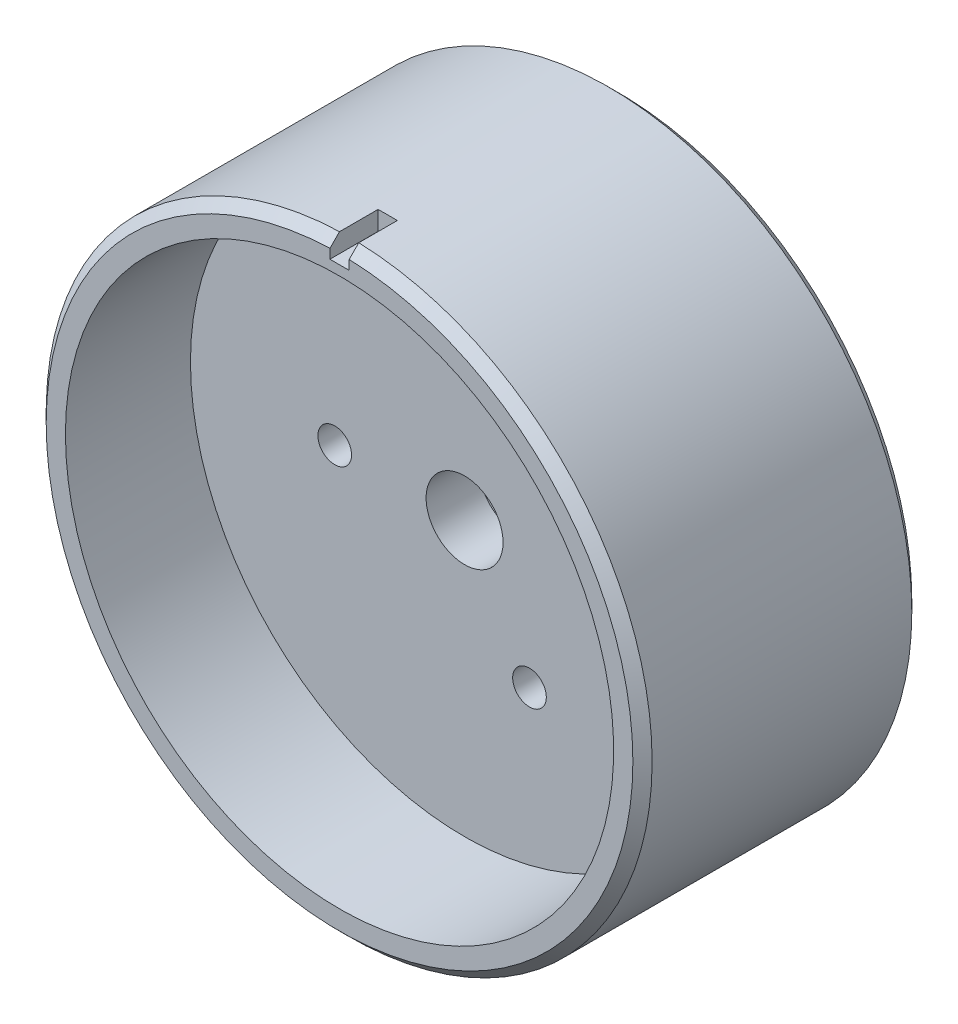
from build123d import *

# Parameters (mm, degrees)
SKETCH_1_R                      = 31.5
SKETCH_1_R_2                    = 1.75
SM_BASE_FLANGE_1_DEPTH          = 16
CHAMFER_1_SIZE                  = 1
SKETCH_12_R                     = 15.75
CUT_EXTRUDE_2_DEPTH             = 6
HOLE_WIZARD_1_D                 = 8
HOLE_WIZARD_1_DEPTH             = 5.5
CHAMFER_2_SIZE                  = 0.5
HOLE_WIZARD_6_0_1_D             = 6
HOLE_WIZARD_6_0_1_DEPTH         = 6
HOLE_WIZARD_6_0_1_TIP           = 1.802581857
SKETCH_11_R                     = 3.25
CUT_EXTRUDE_1_DEPTH             = 4
CUT_EXTRUDE_1_DIRECTION_2_REACH = 47.656
SKETCH_10_R                     = 2.65
CUT_EXTRUDE_41_DEPTH            = 8
SWEEP_3_PITCH                   = 1
PATTERN_CIRCULAR_1_COUNT        = 4
PATTERN_CIRCULAR_2_COUNT        = 2
PATTERN_CIRCULAR_2_ANGLE        = 24
EXTRUDE_START                   = 13
SKETCH_125_R                    = 31.5
SKETCH_125_R_2                  = 28.5
EXTRUDE_1_DEPTH                 = 13
CUT_EXTRUDE_START               = 31.5
SKETCH_124_W                    = 2
SKETCH_124_H                    = 5
CUT_EXTRUDE_42_DEPTH            = 2
CHAMFER_3_SIZE                  = 1


with BuildPart() as part:
    # Базовая кромка1: sheet metal written as solids
    # Sketch 1 → Базовая кромка1 (new body)
    with BuildSketch(Plane.XY):
        Circle(SKETCH_1_R)
        with Locations((-13.5, 0)):
            Circle(SKETCH_1_R_2, mode=Mode.SUBTRACT)
        with Locations((6.75, 11.691342951)):
            Circle(SKETCH_1_R_2, mode=Mode.SUBTRACT)
        with Locations((6.75, -11.691342951)):
            Circle(SKETCH_1_R_2, mode=Mode.SUBTRACT)
    extrude(amount=-SM_BASE_FLANGE_1_DEPTH)

    # Фаска1
    chamfer_1_edges = [part.edges().sort_by_distance(p)[0] for p in [
        (-31.5, 0, -16),
    ]]
    chamfer(chamfer_1_edges, length=CHAMFER_1_SIZE)

    # Эскиз12 → Вырез-Вытянуть2 (cut)
    with BuildSketch(Plane(origin=(0, 0, -16), x_dir=(-1, 0, 0), z_dir=(0, 0, -1))):
        Circle(SKETCH_12_R)
    extrude(amount=-CUT_EXTRUDE_2_DEPTH, mode=Mode.SUBTRACT)

    # Отверстие1
    with Locations(Plane.XY):
        with Locations((0, 0)):
            Hole(HOLE_WIZARD_1_D / 2, depth=HOLE_WIZARD_1_DEPTH)

    # Фаска2
    chamfer_2_edges = [part.edges().sort_by_distance(p)[0] for p in [
        (15.75, 0, -16),
    ]]
    chamfer(chamfer_2_edges, length=CHAMFER_2_SIZE)

    # Отверстия под штифты Ø6.0 мм1
    with Locations(Plane(origin=(0, 25, -16), x_dir=(-1, 0, 0), z_dir=(0, 0, -1))):
        with Locations((0, 0)):
            Hole(HOLE_WIZARD_6_0_1_D / 2, depth=HOLE_WIZARD_6_0_1_DEPTH)
            with Locations((0, 0, -(HOLE_WIZARD_6_0_1_DEPTH + HOLE_WIZARD_6_0_1_TIP / 2))):  # 118° drill point
                Cone(0, HOLE_WIZARD_6_0_1_D / 2, HOLE_WIZARD_6_0_1_TIP, mode=Mode.SUBTRACT)

    # Эскиз11 → Вырез-Вытянуть1 (cut)
    with BuildSketch(Plane(origin=(0, 0, -10), x_dir=(-1, 0, 0), z_dir=(0, 0, -1))):
        with Locations(Location((13.5, 0, 0), (0, 0, 309.022802532))):
            Circle(SKETCH_11_R)
        with Locations(Location((-6.75, -11.691342951, 0), (0, 0, 189.022802465))):
            Circle(SKETCH_11_R)
        with Locations(Location((-6.75, 11.691342951, 0), (0, 0, 170.977197435))):
            Circle(SKETCH_11_R)
    extrude(amount=-CUT_EXTRUDE_1_DEPTH, mode=Mode.SUBTRACT)

    # Эскиз11 → Вырез-Вытянуть1 direction 2 (cut, up to next)
    with BuildSketch(Plane(origin=(0, 0, -10), x_dir=(-1, 0, 0), z_dir=(0, 0, -1)), mode=Mode.PRIVATE) as cut_extrude_1_direction_2_sk1:
        with Locations(Location((13.5, 0, 0), (0, 0, 309.022802532))):
            Circle(SKETCH_11_R)
    cut_extrude_1_direction_2_tool1 = extrude(cut_extrude_1_direction_2_sk1.sketch, amount=CUT_EXTRUDE_1_DIRECTION_2_REACH, mode=Mode.PRIVATE) & part.part
    # Эскиз11 → Вырез-Вытянуть1 direction 2 (cut, up to next)
    with BuildSketch(Plane(origin=(0, 0, -10), x_dir=(-1, 0, 0), z_dir=(0, 0, -1)), mode=Mode.PRIVATE) as cut_extrude_1_direction_2_sk2:
        with Locations(Location((-6.75, -11.691342951, 0), (0, 0, 189.022802465))):
            Circle(SKETCH_11_R)
    cut_extrude_1_direction_2_tool2 = extrude(cut_extrude_1_direction_2_sk2.sketch, amount=CUT_EXTRUDE_1_DIRECTION_2_REACH, mode=Mode.PRIVATE) & part.part
    # Эскиз11 → Вырез-Вытянуть1 direction 2 (cut, up to next)
    with BuildSketch(Plane(origin=(0, 0, -10), x_dir=(-1, 0, 0), z_dir=(0, 0, -1)), mode=Mode.PRIVATE) as cut_extrude_1_direction_2_sk3:
        with Locations(Location((-6.75, 11.691342951, 0), (0, 0, 170.977197435))):
            Circle(SKETCH_11_R)
    cut_extrude_1_direction_2_tool3 = extrude(cut_extrude_1_direction_2_sk3.sketch, amount=CUT_EXTRUDE_1_DIRECTION_2_REACH, mode=Mode.PRIVATE) & part.part
    add(cut_extrude_1_direction_2_tool1.solids().sort_by_distance((-13.5, 0, -10))[0], mode=Mode.SUBTRACT)
    add(cut_extrude_1_direction_2_tool2.solids().sort_by_distance((6.75, -11.691343, -10))[0], mode=Mode.SUBTRACT)
    add(cut_extrude_1_direction_2_tool3.solids().sort_by_distance((6.75, 11.691343, -10))[0], mode=Mode.SUBTRACT)

    # Эскиз10 → Вырез-Вытянуть41 (cut)
    with BuildSketch(Plane(origin=(-35.533284196, 12.717410454, -16), x_dir=(-1, 0, 0), z_dir=(0, 0, -1))):
        with Locations((-53.210953725, 4.960259076)):
            Circle(SKETCH_10_R)
    cut_extrude_41 = extrude(amount=-CUT_EXTRUDE_41_DEPTH, mode=Mode.SUBTRACT)

    # Вырез-По траектории3: arcs per turn and ends read off the stored shape
    # Вырез-По траектории3: the profile of Эскиз121 profile screwed along a right-hand helix through 11 turns, 8 arcs to a turn; built about Z, then put on its axis
    sweep_3_z = Axis((0, 0, 0), (0, 0, 1))
    sweep_3_corners = [(2.6497, 0, -0.549826795), (2.6497, 0, -1.450173205), (3.35, 0, -1.045854812), (3.35, 0, -0.954145188)]
    with BuildLine(mode=Mode.PRIVATE) as sweep_3_profile:
        Line(sweep_3_corners[0], sweep_3_corners[1])
        Line(sweep_3_corners[1], sweep_3_corners[2])
        Line(sweep_3_corners[2], sweep_3_corners[3])
        Line(sweep_3_corners[3], sweep_3_corners[0])
    sweep_3_cap = Face(sweep_3_profile.wire())
    sweep_3_turn_angles = [0, 22.5, 45, 67.5, 90, 112.5, 135, 157.5, 180, 202.5, 225, 247.5, 270, 292.5, 315, 337.5, 360]
    sweep_3_turn_weights = [1, 0.9238795325112867, 1, 0.9238795325112867, 1, 0.9238795325112867, 1, 0.9238795325112867, 1, 0.9238795325112867, 1, 0.9238795325112867, 1, 0.9238795325112867, 1, 0.9238795325112867, 1]
    sweep_3_turn_rails = [Edge.make_bspline([Vector(p[0], p[1], 0).rotate(sweep_3_z, sweep_3_turn_angles[k]) / sweep_3_turn_weights[k] + Vector(0, 0, p[2] + SWEEP_3_PITCH * sweep_3_turn_angles[k] / 360) for k in range(17)], [0, 0, 0, 1, 1, 2, 2, 3, 3, 4, 4, 5, 5, 6, 6, 7, 7, 8, 8, 8], 2, sweep_3_turn_weights) for p in sweep_3_corners]
    sweep_3_turn_sides = [Face.make_surface_from_curves(sweep_3_turn_rails[p[0]], sweep_3_turn_rails[p[1]]) for p in [(0, 1), (1, 2), (2, 3), (3, 0)]]
    sweep_3 = Plane(origin=(17.67766953, 17.67766953, -16), x_dir=(-1, 0, 0), z_dir=(0, 0, 1)) * Solid(Shell([*[p.moved(Location((0, 0, SWEEP_3_PITCH * i))) for i in range(11) for p in sweep_3_turn_sides], sweep_3_cap, sweep_3_cap.rotate(sweep_3_z, 3960).moved(Location((0, 0, SWEEP_3_PITCH * 3960 / 360)))]))
    add(sweep_3, mode=Mode.SUBTRACT)

    # Круговой массив1: Вырез-Вытянуть41, Вырез-По траектории3 ×4 about axis
    pattern_circular_1_axis = Axis((0, 0, -16), (0, 0, 1))
    add([cut_extrude_41.rotate(pattern_circular_1_axis, i * 360 / PATTERN_CIRCULAR_1_COUNT) for i in range(1, PATTERN_CIRCULAR_1_COUNT)], mode=Mode.SUBTRACT)
    add([sweep_3.rotate(pattern_circular_1_axis, i * 360 / PATTERN_CIRCULAR_1_COUNT) for i in range(1, PATTERN_CIRCULAR_1_COUNT)], mode=Mode.SUBTRACT)

    # Эскиз123 → Вырез-Повернуть1 (revolve, cut)
    with BuildSketch(Plane(origin=(0, 0, -8.5), x_dir=(-1, 0, 0), z_dir=(0, 0, -1)), mode=Mode.PRIVATE) as cut_revolve_1_sk:
        Polygon((22.858890762, -2.543838267), (22.632157351, -4.581261139), (31.576940693, -5.576676113), (31.803674104, -3.53925324), align=None)
    cut_revolve_1 = revolve(cut_revolve_1_sk.sketch.rotate(Axis((0, 0, -8.5), (-0.9938648157435338, -0.11060166376267475, 0)), 180), axis=Axis((0, 0, -8.5), (-0.9938648157435338, -0.11060166376267475, 0)), mode=Mode.SUBTRACT)

    # Круговой массив2: Вырез-Повернуть1 ×2 about axis
    pattern_circular_2_axis = Axis((0, 0, -16), (0, 0, -1))
    for i in range(1, PATTERN_CIRCULAR_2_COUNT):
        add(cut_revolve_1.rotate(pattern_circular_2_axis, i * PATTERN_CIRCULAR_2_ANGLE / (PATTERN_CIRCULAR_2_COUNT - 1)), mode=Mode.SUBTRACT)

    # Эскиз125 → Бобышка-Вытянуть1 (add)
    with BuildSketch(Plane.XY.offset(EXTRUDE_START)):
        Circle(SKETCH_125_R)
        with Locations(Location((0, 0, 0), (0, 0, 180))):
            Circle(SKETCH_125_R_2, mode=Mode.SUBTRACT)
    extrude(amount=-EXTRUDE_1_DEPTH)

    # Эскиз124 → Вырез-Вытянуть42 (cut)
    with BuildSketch(Plane(origin=(0, 0, 0), x_dir=(1, 0, 0), z_dir=(0, 1, 0)).offset(CUT_EXTRUDE_START)):
        with Locations((0, -10.5)):
            Rectangle(SKETCH_124_W, SKETCH_124_H)
    extrude(amount=-CUT_EXTRUDE_42_DEPTH, mode=Mode.SUBTRACT)

    # Фаска3
    chamfer_3_edges = [part.edges().sort_by_distance(p)[0] for p in [
        (-21.917458794, -22.624654693, 13),
    ]]
    chamfer(chamfer_3_edges, length=CHAMFER_3_SIZE)


solid = part.part
